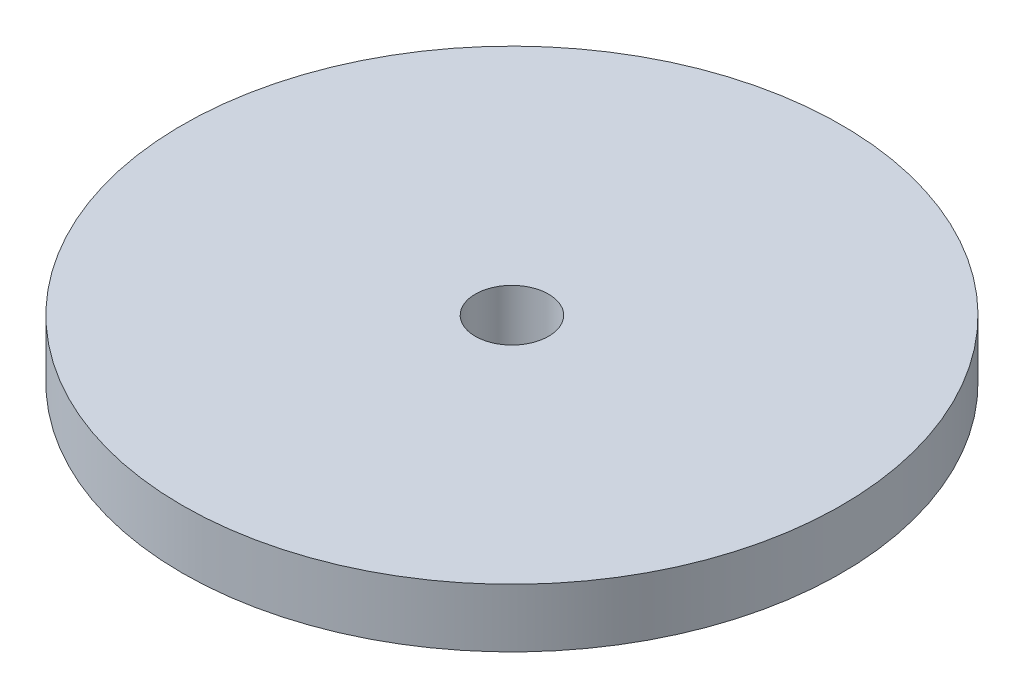
from build123d import *


with BuildPart() as part:
    # Esquisse1 → Révolution1 (revolve)
    with BuildSketch(Plane.XY):
        Polygon((2.5, 2), (2.5, -13), (4, -13), (4, -2), (22.5, -2), (22.5, 2), align=None)
    revolve(axis=Axis((0, 8.626576325, 0), (0, -1, 0)))


solid = part.part
